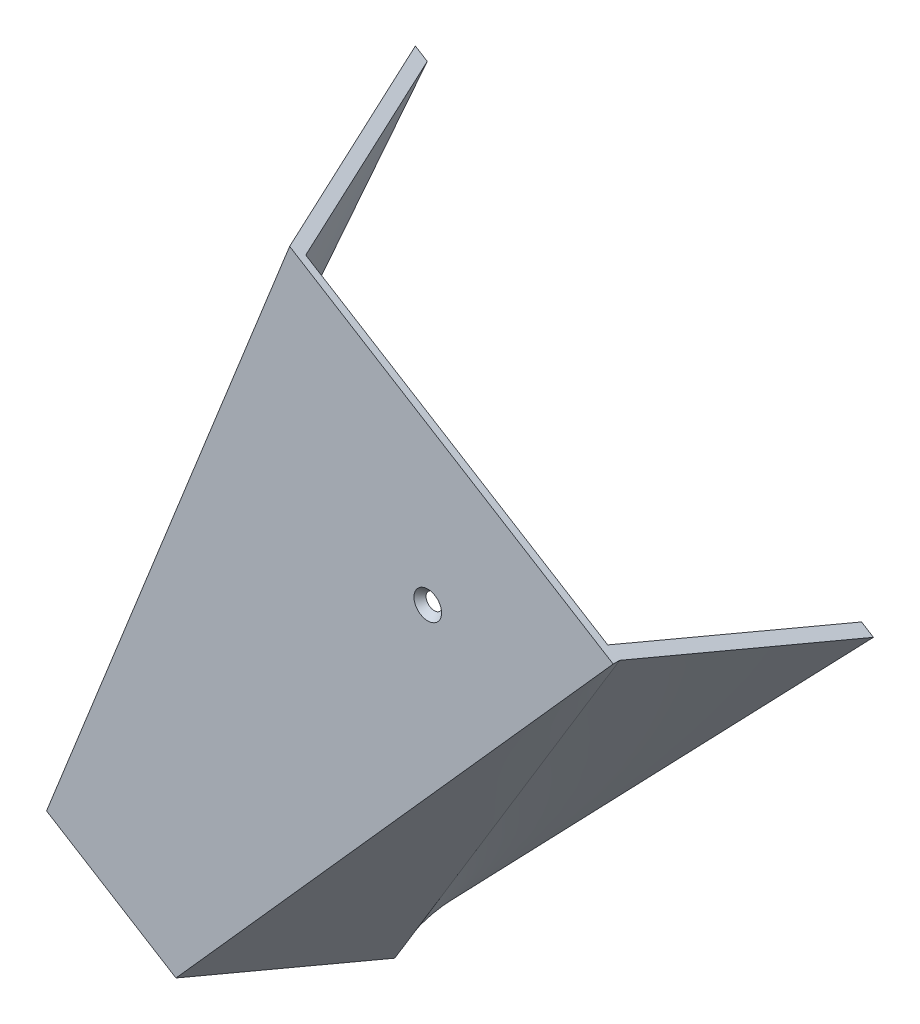
from build123d import *

# Parameters (mm, degrees)
BOSS_EXTRUDE1_DEPTH                               = 1
CSK_FOR_1_FLAT_HEAD_SOCKET_CAP_SCREW1_D           = 2.0574
CSK_FOR_1_FLAT_HEAD_SOCKET_CAP_SCREW1_CSINK_D     = 4.2672
CSK_FOR_1_FLAT_HEAD_SOCKET_CAP_SCREW1_CSINK_ANGLE = 82


with BuildPart() as part:
    # Sketch1 → Boss-Extrude1 (new body)
    with BuildSketch(Plane.XY):
        Polygon((99.80287108, 7.560475543), (62.236469572, -86.777626616), (82.236469572, -99.136126436), (149.80287108, -23.335774006), align=None)
    extrude(amount=BOSS_EXTRUDE1_DEPTH)

    # Loft3: read off the stored shape, not the designer's step
    # Loft3: loft between two sections, ruled curve by curve
    loft3_from = [
        Edge.make_bspline([(158.179985747, -28.512202511, -29), (158.486913307, -28.701860721, -29), (158.793840868, -28.891518931, -29), (159.407695988, -29.270835351, -29), (159.714623549, -29.460493561, -29), (160.021551109, -29.650151771, -29)], [0, 0, 0, 0, 0.5, 0.5, 1, 1, 1, 1], 3),
        Edge.make_bspline([(147.608937441, -21.980087582, 1), (149.370778826, -23.068773403, -4), (151.13262021, -24.157459225, -9), (154.656302978, -26.334830868, -19), (156.418144363, -27.423516689, -24), (158.179985747, -28.512202511, -29)], [0, 0, 0, 0, 0.5, 0.5, 1, 1, 1, 1], 3),
        Edge.make_bspline([(160.021551109, -29.650151771, -29), (158.318437771, -28.597755477, -24.166666667), (156.615324433, -27.545359183, -19.333333333), (153.209097757, -25.440566594, -9.666666667), (151.505984418, -24.3881703, -4.833333333), (149.80287108, -23.335774006, 0)], [0, 0, 0, 0, 0.5, 0.5, 1, 1, 1, 1], 3),
        Edge.make_bspline([(149.80287108, -23.335774006, 0), (149.80287108, -23.335774006, 0.166666667), (149.80287108, -23.335774006, 0.333333333), (149.80287108, -23.335774006, 0.666666667), (149.80287108, -23.335774006, 0.833333333), (149.80287108, -23.335774006, 1)], [0, 0, 0, 0, 0.5, 0.5, 1, 1, 1, 1], 3),
        Edge.make_line((149.80287108, -23.335774006, 1), (147.608937441, -21.980087582, 1)),
    ]
    loft3_to = [
        Edge.make_bspline([(80.395510173, -97.998551616, 0.998280313), (81.863610332, -98.905727394, -3.168099739), (83.331710492, -99.812903172, -7.334479791), (86.267910812, -101.627254727, -15.667239896), (87.736010971, -102.534430505, -19.833619948), (89.204111131, -103.441606283, -24)], [0, 0, 0, 0, 0.5, 0.5, 1, 1, 1, 1], 3),
        Edge.make_bspline([(80.395510173, -97.998551616, 1), (80.395510173, -97.998551616, 0.99971966), (80.395510173, -97.998551616, 0.999436182), (80.395510173, -97.998551616, 0.998862953), (80.395510173, -97.998551616, 0.998573202), (80.395510173, -97.998551616, 0.998280313)], [0, 0, 0, 0, 0.5, 0.5, 1, 1, 1, 1], 3),
        Edge.make_bspline([(89.204111131, -103.441606283, -24), (89.511038691, -103.631264493, -24), (89.817966252, -103.820922703, -24), (90.431821372, -104.200239123, -24), (90.738748933, -104.389897333, -24), (91.045676493, -104.579555543, -24)], [0, 0, 0, 0, 0.5, 0.5, 1, 1, 1, 1], 3),
        Edge.make_bspline([(91.045676493, -104.579555543, -24), (89.57747534, -103.672317359, -19.833333333), (88.109274186, -102.765079174, -15.666666667), (85.172871879, -100.950602805, -7.333333333), (83.704670725, -100.04336462, -3.166666667), (82.236469572, -99.136126436, 1)], [0, 0, 0, 0, 0.5, 0.5, 1, 1, 1, 1], 3),
        Edge.make_line((82.236469572, -99.136126436, 1), (80.395510173, -97.998551616, 1)),
    ]
    loft3 = Solid(Shell([*[Face.make_surface_from_curves(loft3_from[k], loft3_to[k]) for k in range(5)], Face(Wire(loft3_from)), Face(Wire(loft3_to))]))
    add(loft3)

    # Sketch12 → Loft4 section 0
    with BuildSketch(Plane(origin=(30.958675209, 50.101024656, 0), x_dir=(0.8506922729426725, -0.5256640150853298, 0), z_dir=(0.5256640150853298, 0.8506922729426725, 0))):
        with BuildLine():
            Line((82.677832154, -1), (82.677832154, 0))
            Line((82.677832154, 0), (70.665638845, 29))
            Line((70.665638845, 29), (68.500854444, 29))
            Line((68.500854444, 29), (80.927261316, -1))
            Line((80.927261316, -1), (82.677832154, -1))
        make_face()
    # Sketch13 → Loft4 section 1
    with BuildSketch(Plane(origin=(-21.6077263, -34.968202638, 0), x_dir=(-0.8506922729426724, 0.52566401508533, 0), z_dir=(-0.52566401508533, -0.8506922729426724, 0))):
        with BuildLine():
            Line((-98.864477851, -1), (-84.60323453, 24))
            Line((-84.60323453, 24), (-86.905766091, 24))
            Line((-86.905766091, 24), (-94.44679393, 10.780556805))
            Line((-94.44679393, 10.780556805), (-101.167009412, -1))
            Line((-101.167009412, -1), (-98.864477851, -1))
        make_face()
    loft()

    # CSK for #1 Flat Head Socket Cap Screw1 (through all)
    with Locations(Plane.XY.offset(1)):
        with Locations((121.150579346, -29.757979407)):
            CounterSinkHole(CSK_FOR_1_FLAT_HEAD_SOCKET_CAP_SCREW1_D / 2, CSK_FOR_1_FLAT_HEAD_SOCKET_CAP_SCREW1_CSINK_D / 2, counter_sink_angle=CSK_FOR_1_FLAT_HEAD_SOCKET_CAP_SCREW1_CSINK_ANGLE)


solid = part.part
